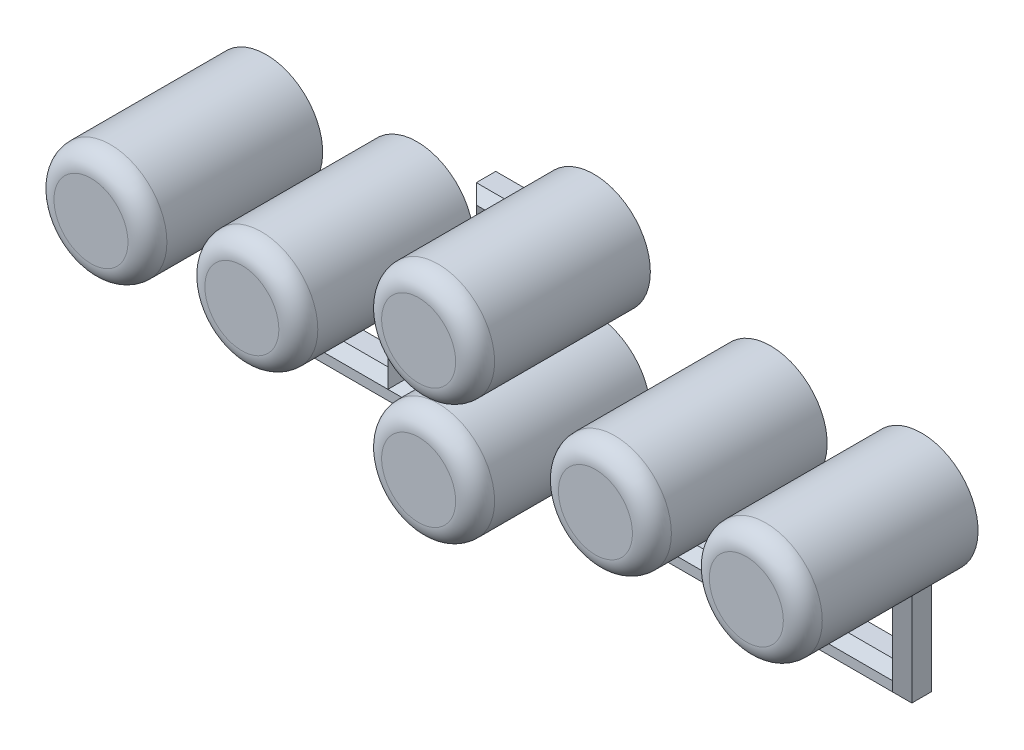
from build123d import *

# Parameters (mm, degrees)
SKETCH_1_R        = 2.9
EXTRUDE_1_DEPTH   = 9
EXTRUDE_1_2_DEPTH = 9
EXTRUDE_1_3_DEPTH = 9
EXTRUDE_1_4_DEPTH = 9
EXTRUDE_1_5_DEPTH = 9
EXTRUDE_1_6_DEPTH = 9
EXTRUDE_2_DEPTH   = 1.5
CHAMFER_1_SIZE    = 0.5
CHAMFER_2_SIZE    = 0.5
CHAMFER_3_SIZE    = 0.5
CHAMFER_4_SIZE    = 0.5
FILLET_2_R        = 1


with BuildPart() as part:
    # Эскиз1 → Бобышка-Вытянуть1 (new body)
    with BuildSketch(Plane.XY):
        with Locations((33.66, 0)):
            Circle(SKETCH_1_R)
    extrude(amount=EXTRUDE_1_DEPTH)



with BuildPart() as body_2:
    # Эскиз1 → Extrude 1 2 (new body)
    with BuildSketch(Plane.XY):
        with Locations((25.91, 0)):
            Circle(SKETCH_1_R)
    extrude(amount=EXTRUDE_1_2_DEPTH)


with BuildPart() as body_3:
    # Эскиз1 → Extrude 1 3 (new body)
    with BuildSketch(Plane.XY):
        with Locations((16.83, -3.1)):
            Circle(SKETCH_1_R)
    extrude(amount=EXTRUDE_1_3_DEPTH)


with BuildPart() as body_4:
    # Эскиз1 → Extrude 1 4 (new body)
    with BuildSketch(Plane.XY):
        with Locations((7.75, 0)):
            Circle(SKETCH_1_R)
    extrude(amount=EXTRUDE_1_4_DEPTH)


with BuildPart() as body_5:
    # Эскиз1 → Extrude 1 5 (new body)
    with BuildSketch(Plane.XY):
        Circle(SKETCH_1_R)
    extrude(amount=EXTRUDE_1_5_DEPTH)


with BuildPart() as body_6:
    # Эскиз1 → Extrude 1 6 (new body)
    with BuildSketch(Plane.XY):
        with Locations((16.83, 3.1)):
            Circle(SKETCH_1_R)
    extrude(amount=EXTRUDE_1_6_DEPTH)


with BuildPart() as part_1:
    add(part.part)

    add(body_2.part)  # Бобышка-Вытянуть2 merges body 2

    add(body_3.part)  # Бобышка-Вытянуть2 merges body 3

    add(body_4.part)  # Бобышка-Вытянуть2 merges body 4

    add(body_5.part)  # Бобышка-Вытянуть2 merges body 5

    add(body_6.part)  # Бобышка-Вытянуть2 merges body 6
    # Эскиз2 → Бобышка-Вытянуть2 (add)
    with BuildSketch(Plane(origin=(0, 0, 0), x_dir=(-1, 0, 0), z_dir=(0, 0, -1))):
        Polygon((0, 0), (0.5, 0), (0.5, -8.365233443), (-34.16, -8.365233443), (-34.16, 0), (-33.66, 0), (-33.16, 0), (-33.16, -6.865233443), (-26.41, -6.865233443), (-26.41, 0), (-25.41, 0), (-25.41, -6.865233443), (-21.87, -6.865233443), (-21.87, -2.6), (-16.83, -2.6), (-16.83, -3.1), (-16.83, -3.6), (-20.87, -3.6), (-20.87, -6.865233443), (-12.79, -6.865233443), (-12.79, 2.6), (-16.83, 2.6), (-16.83, 3.1), (-16.83, 3.6), (-11.79, 3.6), (-11.79, -6.865233443), (-8.25, -6.865233443), (-8.25, 0), (-7.75, 0), (-7.25, 0), (-7.25, -6.865233443), (-0.5, -6.865233443), (-0.5, 0), align=None)
    extrude(amount=-EXTRUDE_2_DEPTH)

    # Фаска1
    chamfer_1_edges = [part_1.edges().sort_by_distance(p)[0] for p in [
        (12.79, -2.132616721, 1.5),
        (16.83, -6.865233443, 1.5),
        (20.87, -5.232616721, 1.5),
        (20.778285686, -2.6, 1.5),
        (21.87, -4.732616721, 1.5),
        (25.41, -4.860902407, 1.5),
        (26.41, -4.860902407, 1.5),
        (29.785, -6.865233443, 1.5),
        (33.16, -4.860902407, 1.5),
        (16.83, -8.365233443, 1.5),
        (34.16, -5.610902407, 1.5),
    ]]
    chamfer(chamfer_1_edges, length=CHAMFER_1_SIZE - 0.0001)  # a hair under: the kernel refuses the full size

    # Фаска2
    chamfer_2_edges = [part_1.edges().sort_by_distance(p)[0] for p in [
        (13.131764314, 2.6, 1.5),
    ]]
    chamfer(chamfer_2_edges, length=CHAMFER_2_SIZE - 0.0001)  # a hair under: the kernel refuses the full size

    # Фаска3
    chamfer_3_edges = [part_1.edges().sort_by_distance(p)[0] for p in [
        (-0.5, -5.360952407, 1.5),
        (0.5, -4.860902407, 1.5),
        (3.875, -6.865233443, 1.5),
        (7.25, -4.860902407, 1.5),
        (8.25, -4.860902407, 1.5),
        (10.02, -6.865233443, 1.5),
        (11.79, -1.632616721, 1.5),
        (12.881714314, 3.6, 1.5),
    ]]
    chamfer(chamfer_3_edges, length=CHAMFER_3_SIZE - 0.0001)  # a hair under: the kernel refuses the full size

    # Фаска4
    chamfer_4_edges = [part_1.edges().sort_by_distance(p)[0] for p in [
        (23.64, -6.865233443, 1.5),
    ]]
    chamfer(chamfer_4_edges, length=CHAMFER_4_SIZE)

    # Скругление2
    fillet_2_edges = [part_1.edges().sort_by_distance(p)[0] for p in [
        (30.76, 0, 9),
        (23.01, 0, 9),
        (4.85, 0, 9),
        (-2.9, 0, 9),
        (13.93, 3.1, 9),
        (13.93, -3.1, 9),
    ]]
    fillet(fillet_2_edges, radius=FILLET_2_R)


solid = part_1.part
